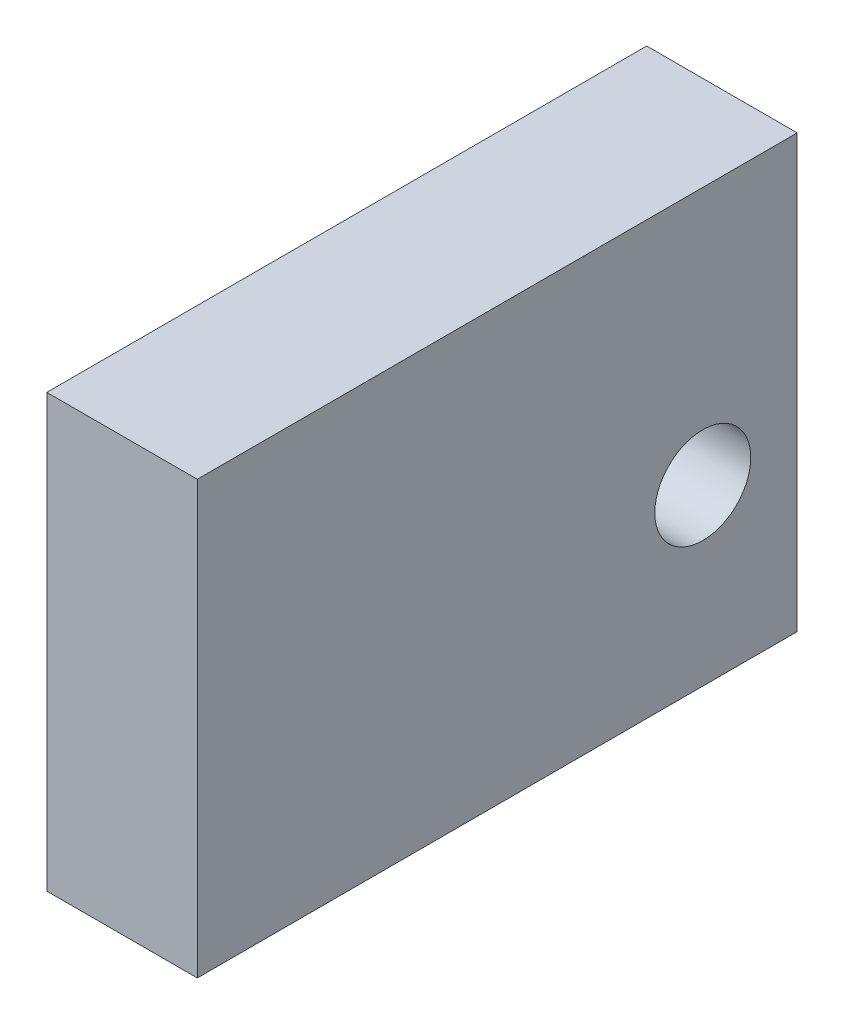
from build123d import *

# Parameters (mm, degrees)
SKETCH1_W           = 15.928987192
SKETCH1_H           = 63.5
BOSS_EXTRUDE1_DEPTH = 45.72
SKETCH2_R           = 5.08
CUT_EXTRUDE1_DEPTH  = 50.8


with BuildPart() as part:
    # Sketch1 → Boss-Extrude1 (new body)
    with BuildSketch(Plane(origin=(0, 0, 0), x_dir=(1, 0, 0), z_dir=(0, 1, 0))):
        with Locations((6.583463804, 0.077884411)):
            Rectangle(SKETCH1_W, SKETCH1_H)
    extrude(amount=BOSS_EXTRUDE1_DEPTH)

    # Sketch2 → Cut-Extrude1 (cut)
    with BuildSketch(Plane.ZY.offset(1.381029792)):
        with Locations((-21.83436844, 18.424847607)):
            Circle(SKETCH2_R)
    extrude(amount=-CUT_EXTRUDE1_DEPTH, mode=Mode.SUBTRACT)


solid = part.part
